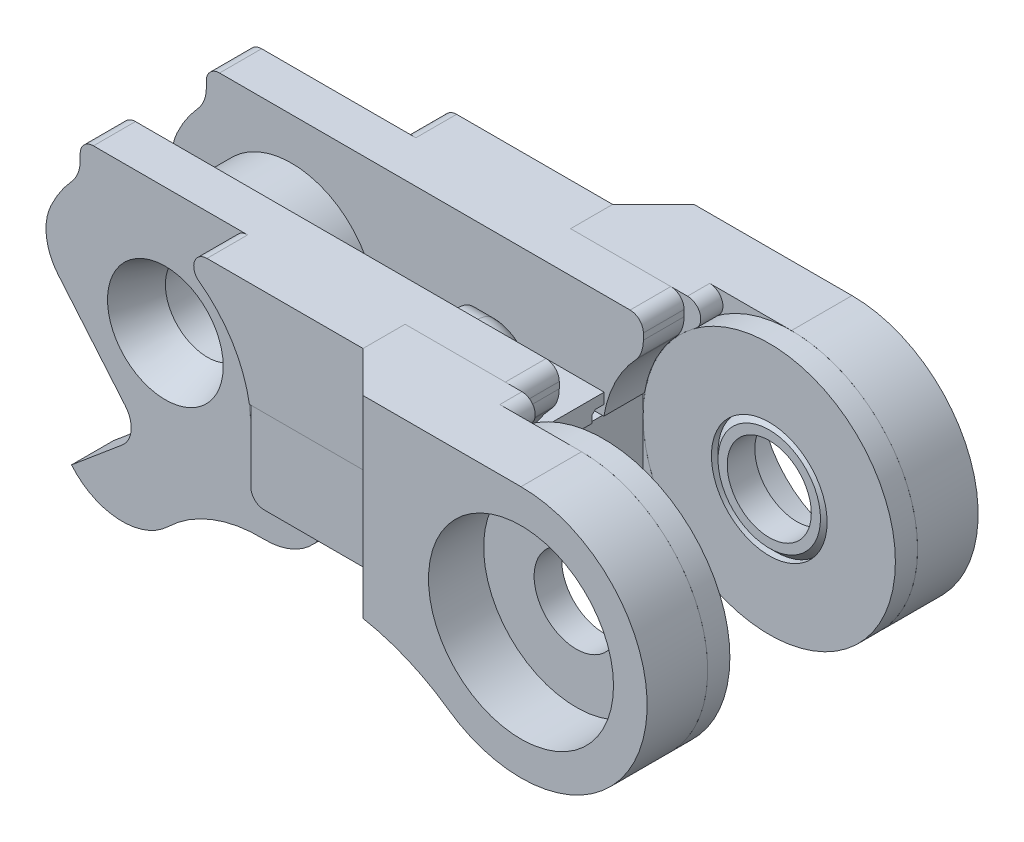
from build123d import *
from build123d.topology import SkipClean

# Parameters (mm, degrees)
SKETCH1_W                  = 7.108223344
SKETCH1_H                  = 0.79375
BOSS_EXTRUDE1_DEPTH        = 1.5875
BOSS_EXTRUDE2_START        = 1.5875
SKETCH1_4_R                = 1.5875
BOSS_EXTRUDE2_DEPTH        = 3.1242
BOSS_EXTRUDE3_START        = -1.5875
SKETCH1_5_R                = 1.5875
BOSS_EXTRUDE3_DEPTH        = 3.1242
BOSS_EXTRUDE4_START        = -4.7117
BOSS_EXTRUDE4_DEPTH        = 9.4234
CUT_EXTRUDE2_DEPTH         = 15.63580129
CUT_EXTRUDE2_DEPTH_BACK    = 15.63580129
SKETCH2_W                  = 0.458271776
SKETCH2_H                  = 0.396875
SKETCH3_R                  = 4.7625
SKETCH3_R_2                = 1.5875
CUT_EXTRUDE3_DEPTH         = 15.63580129
BOSS_EXTRUDE6_START        = 4.7117
SKETCH3_5_R                = 1.5875
BOSS_EXTRUDE6_DEPTH        = 1.5367
CUT_EXTRUDE5_START         = 1.5875
SKETCH4_R                  = 0.79375
CUT_EXTRUDE5_DEPTH         = 17.78779819
CHAMFER7_SIZE              = 0.125
CUT_EXTRUDE11_DEPTH        = 4.7117
FILLET1_R                  = 1.25
CUT_EXTRUDE7_DEPTH         = 16.20029819
CUT_EXTRUDE7_DEPTH_BACK    = 16.20029819
BOSS_EXTRUDE10_START       = 1.5875
BOSS_EXTRUDE10_DEPTH       = 3.1242
FILLET6_R                  = 1.5875
CHAMFER2_SIZE              = 1.5367
SKETCH8_R                  = 0.79375
CUT_EXTRUDE8_START         = 4.7117
CUT_EXTRUDE8_DEPTH         = 1.5875
BOSS_EXTRUDE12_START       = 3.1242
SKETCH3_8_R                = 1.5875
BOSS_EXTRUDE12_DEPTH       = 1.58752
BOSS_EXTRUDE17_START       = 1.5875
BOSS_EXTRUDE17_DEPTH       = 3.1242
CUT_EXTRUDE10_START        = 3.175
CUT_EXTRUDE10_OUTLINE_R    = 1.5875
CUT_EXTRUDE10_DEPTH        = 1.5367
BOSS_EXTRUDE18_START       = 1.5875
BOSS_EXTRUDE18_DEPTH       = 1.5875
FILLET11_R                 = 1.25
FILLET13_R                 = 0.5
BOSS_EXTRUDE14_START       = -1.5875
BOSS_EXTRUDE14_OUTLINE_R   = 3.175
BOSS_EXTRUDE14_OUTLINE_R_2 = 1.5875
BOSS_EXTRUDE14_DEPTH       = 3.175
BOSS_EXTRUDE15_START       = 3.175
BOSS_EXTRUDE15_DEPTH       = 6.2992
FILLET10_R                 = 0.5
CUT_EXTRUDE13_START        = 6.2484
SKETCH15_R                 = 3.4925
SKETCH15_R_2               = 1.5875
CUT_EXTRUDE13_DEPTH        = 2.0828
CUT_EXTRUDE14_START        = 3.1242
SKETCH17_R                 = 4.7625
SKETCH17_R_2               = 2.1844
SKETCH17_R_3               = 1.5875
CUT_EXTRUDE14_DEPTH        = 0.8382
BOSS_EXTRUDE22_START       = 3.1242
SKETCH17_5_R               = 2.1844
SKETCH17_5_R_2             = 1.5875
BOSS_EXTRUDE22_DEPTH       = 0.8382
CHAMFER4_SIZE              = 0.25
FILLET16_START             = 3.1242
FILLET16_DEPTH             = 0.8382
BOSS_EXTRUDE20_START       = 3.9624
SKETCH17_2_R               = 4.7625
SKETCH17_2_R_2             = 2.1844
BOSS_EXTRUDE20_DEPTH       = 0.8382
CUT_EXTRUDE15_START        = 3.175
CUT_EXTRUDE15_DEPTH        = 2.825
FILLET8_R                  = 0.5
CHAMFER5_SIZE              = 0.5969
CHAMFER5_SIZE_2            = 1.5875
SKETCH19_R                 = 4.7752
SKETCH19_R_2               = 2.1844
CUT_EXTRUDE17_DEPTH        = 3.1242
FILLET17_R                 = 0.5


with BuildPart() as part:
    # Sketch1 → Boss-Extrude1 (new, symmetric)
    with BuildSketch(Plane.XY):
        with Locations((0, 1.190625)):
            Rectangle(SKETCH1_W, SKETCH1_H)
    extrude(amount=BOSS_EXTRUDE1_DEPTH, both=True)

    # Sketch2 → Cut-Extrude2 (cut, two sides: drawn at the far end of the back side and taken through both)
    with BuildSketch(Plane(origin=(0, 0, 0), x_dir=(0, 0, -1), z_dir=(1, 0, 0)).offset(-CUT_EXTRUDE2_DEPTH_BACK)):
        with Locations((-1.358364112, 0.9921875)):
            Rectangle(SKETCH2_W, SKETCH2_H)
        with Locations((1.358364112, 0.9921875)):
            Rectangle(SKETCH2_W, SKETCH2_H)
    extrude(amount=CUT_EXTRUDE2_DEPTH + CUT_EXTRUDE2_DEPTH_BACK, mode=Mode.SUBTRACT)


with BuildPart() as body_2:
    # Sketch1<4> → Boss-Extrude2 (new body)
    # profile 1 of 2: a face of its own
    with BuildSketch(Plane.XY.offset(BOSS_EXTRUDE2_START)):
        with BuildLine():
            Line((8.25, 4.7625), (-8.25, 4.7625))
            ThreePointArc((-8.25, 4.7625), (-12.789202371, -1.441196753), (-5.502752244, -3.890248837))
            ThreePointArc((-5.502752244, -3.890248837), (-3.243277531, -2.767556005), (-0.75, -2.38125))
            Line((-0.75, -2.38125), (-3.4875, -2.38125))
            ThreePointArc((-3.4875, -2.38125), (-5.075, -0.79375), (-3.4875, 0.79375))
            Line((-3.4875, 0.79375), (-3.554111672, 0.79375))
            Line((-3.554111672, 0.79375), (-3.554111672, 1.5875))
            Line((-3.554111672, 1.5875), (3.554111672, 1.5875))
            Line((3.554111672, 1.5875), (3.554111672, 0.79375))
            Line((3.554111672, 0.79375), (3.4875, 0.79375))
            ThreePointArc((3.4875, 0.79375), (5.075, -0.79375), (3.4875, -2.38125))
            Line((3.4875, -2.38125), (0.75, -2.38125))
            ThreePointArc((0.75, -2.38125), (3.243277531, -2.767556005), (5.502752244, -3.890248837))
            ThreePointArc((5.502752244, -3.890248837), (12.789202371, -1.441196753), (8.25, 4.7625))
        make_face()
        with Locations((-8.25, 0)):
            Circle(SKETCH1_4_R, mode=Mode.SUBTRACT)
        with Locations((8.25, 0)):
            Circle(SKETCH1_4_R, mode=Mode.SUBTRACT)
    # profile 2 of 2: a face of its own
    with BuildSketch(Plane.XY.offset(BOSS_EXTRUDE2_START)):
        Polygon((-3.554111672, 0.79375), (-3.4875, 0.79375), (0, 0.79375), (3.4875, 0.79375), (3.554111672, 0.79375), (3.554111672, 1.5875), (-3.554111672, 1.5875), align=None)
    extrude(amount=BOSS_EXTRUDE2_DEPTH)

    # Sketch3 → Cut-Extrude3 (cut, through all)
    with BuildSketch(Plane.XY):
        with Locations((8.25, 0)):
            Circle(SKETCH3_R)
        with Locations((8.25, 0)):
            Circle(SKETCH3_R_2, mode=Mode.SUBTRACT)
    extrude(amount=CUT_EXTRUDE3_DEPTH, mode=Mode.SUBTRACT)


with BuildPart() as body_3:
    # Sketch1<5> → Boss-Extrude3 (new body)
    # profile 1 of 2: a face of its own
    with BuildSketch(Plane.XY.offset(BOSS_EXTRUDE3_START)):
        with BuildLine():
            Line((8.25, 4.7625), (-8.25, 4.7625))
            ThreePointArc((-8.25, 4.7625), (-12.789202371, -1.441196753), (-5.502752244, -3.890248837))
            ThreePointArc((-5.502752244, -3.890248837), (-3.243277531, -2.767556005), (-0.75, -2.38125))
            Line((-0.75, -2.38125), (-3.4875, -2.38125))
            ThreePointArc((-3.4875, -2.38125), (-5.075, -0.79375), (-3.4875, 0.79375))
            Line((-3.4875, 0.79375), (-3.554111672, 0.79375))
            Line((-3.554111672, 0.79375), (-3.554111672, 1.5875))
            Line((-3.554111672, 1.5875), (3.554111672, 1.5875))
            Line((3.554111672, 1.5875), (3.554111672, 0.79375))
            Line((3.554111672, 0.79375), (3.4875, 0.79375))
            ThreePointArc((3.4875, 0.79375), (5.075, -0.79375), (3.4875, -2.38125))
            Line((3.4875, -2.38125), (0.75, -2.38125))
            ThreePointArc((0.75, -2.38125), (3.243277531, -2.767556005), (5.502752244, -3.890248837))
            ThreePointArc((5.502752244, -3.890248837), (12.789202371, -1.441196753), (8.25, 4.7625))
        make_face()
        with Locations((-8.25, 0)):
            Circle(SKETCH1_5_R, mode=Mode.SUBTRACT)
        with Locations((8.25, 0)):
            Circle(SKETCH1_5_R, mode=Mode.SUBTRACT)
    # profile 2 of 2: a face of its own
    with BuildSketch(Plane.XY.offset(BOSS_EXTRUDE3_START)):
        Polygon((-3.554111672, 0.79375), (-3.4875, 0.79375), (0, 0.79375), (3.4875, 0.79375), (3.554111672, 0.79375), (3.554111672, 1.5875), (-3.554111672, 1.5875), align=None)
    extrude(amount=-BOSS_EXTRUDE3_DEPTH)


with BuildPart() as body_4:
    # Sketch1<7> → Boss-Extrude4 (new body)
    with BuildSketch(Plane.XY.offset(BOSS_EXTRUDE4_START)):
        Polygon((-3.4875, -2.38125), (-0.75, -2.38125), (0, -2.38125), (0.75, -2.38125), (3.4875, -2.38125), (3.4875, 0), (3.4875, 0.79375), (0, 0.79375), (-3.4875, 0.79375), (-3.4875, 0), align=None)
    extrude(amount=BOSS_EXTRUDE4_DEPTH)


with BuildPart() as body_4_2:
    # of the pieces the cut leaves, the one that is kept (cut_extrude3_keep)
    add(body_2.part.solids().sort_by_distance((-0.75, -2.38125, 1.5875))[0])

    # Sketch13 → Cut-Extrude11 (cut)
    with BuildSketch(Plane.XY):
        with BuildLine():
            ThreePointArc((8.25, 4.7625), (6.524728282, 4.439013826), (5.033829917, 3.5125))
            Line((5.033829917, 3.5125), (5.033829917, 4.7625))
            Line((5.033829917, 4.7625), (8.25, 4.7625))
        make_face()
    extrude(amount=CUT_EXTRUDE11_DEPTH, mode=Mode.SUBTRACT)

    # Fillet1
    fillet1_edges = [body_4_2.edges().sort_by_distance(p)[0] for p in [
        (5.033829917, 3.5125, 3.1496),
    ]]
    fillet(fillet1_edges, radius=FILLET1_R)

    # Sketch6 → Cut-Extrude7 (cut, two sides: drawn at the far end of the back side and taken through both)
    with SkipClean():  # the faces are left unmerged after this step: merging them gives an invalid solid
        with BuildSketch(Plane.XY.offset(-CUT_EXTRUDE7_DEPTH_BACK)):
            with BuildLine():
                ThreePointArc((-12.784199222, 1.456860895), (-12.527084339, -2.094744807), (-9.878870933, -4.475286106))
                ThreePointArc((-9.878870933, -4.475286106), (-9.31783718, -3.397550295), (-9.68320071, -2.238765223))
                Line((-9.68320071, -2.238765223), (-12.784199222, 1.456860895))
            make_face()
            with BuildLine():
                ThreePointArc((-4.064703864, -2.272598183), (-4.690612467, -3.16420079), (-5.502752244, -3.890248837))
                ThreePointArc((-5.502752244, -3.890248837), (-3.818585011, -2.974003651), (-1.96825258, -2.471814041))
                ThreePointArc((-1.96825258, -2.471814041), (-1.967021933, -2.426539453), (-1.966611672, -2.38125))
                Line((-1.966611672, -2.38125), (-3.4875, -2.38125))
                ThreePointArc((-3.4875, -2.38125), (-3.781170529, -2.353850596), (-4.064703864, -2.272598183))
            make_face()
            with BuildLine():
                ThreePointArc((-1.966611672, -2.38125), (-1.967021933, -2.426539453), (-1.96825258, -2.471814041))
                ThreePointArc((-1.96825258, -2.471814041), (-1.360807088, -2.403922205), (-0.75, -2.38125))
                Line((-0.75, -2.38125), (-1.966611672, -2.38125))
            make_face()
        extrude(amount=CUT_EXTRUDE7_DEPTH + CUT_EXTRUDE7_DEPTH_BACK, mode=Mode.SUBTRACT)

    # Boss-Extrude10: read off the stored shape, not the designer's step
    # Boss-Extrude10 outline → Boss-Extrude10 (add)
    with BuildSketch(Plane.XY.offset(BOSS_EXTRUDE10_START)):
        with BuildLine():
            Line((-1.966611672, -2.38125), (-3.4875, -2.38125))
            ThreePointArc((-3.4875, -2.38125), (-3.781170529, -2.353850596), (-4.064703864, -2.272598183))
            ThreePointArc((-4.064703864, -2.272598183), (-6.562757879, -4.453607557), (-9.878870933, -4.475286106))
            Line((-9.878870933, -4.475286106), (-11.79398204, -6.082255131))
            ThreePointArc((-11.79398204, -6.082255131), (-10.011619172, -6.9717592), (-8.14497636, -6.276288498))
            ThreePointArc((-8.14497636, -6.276288498), (-6.481384422, -5.215153517), (-4.53680352, -4.880264427))
            ThreePointArc((-4.53680352, -4.880264427), (-2.723837966, -4.17366173), (-1.966611672, -2.38125))
        make_face()
    extrude(amount=BOSS_EXTRUDE10_DEPTH)

    # Fillet6
    fillet6_edges = [body_4_2.edges().sort_by_distance(p)[0] for p in [
        (-12.784199222, 1.456860895, 3.1496),
    ]]
    fillet(fillet6_edges, radius=FILLET6_R)


with BuildPart() as body_4_3:
    # Sketch3<5> → Boss-Extrude6 (new body)
    with BuildSketch(Plane.XY.offset(BOSS_EXTRUDE6_START)):
        with BuildLine():
            ThreePointArc((0.75, -2.38125), (3.243277531, -2.767556005), (5.502752244, -3.890248837))
            ThreePointArc((5.502752244, -3.890248837), (12.789202371, -1.441196753), (8.25, 4.7625))
            Line((8.25, 4.7625), (0.75, 4.7625))
            Line((0.75, 4.7625), (0.75, -2.38125))
        make_face()
        with Locations((8.25, 0)):
            Circle(SKETCH3_5_R, mode=Mode.SUBTRACT)
    extrude(amount=BOSS_EXTRUDE6_DEPTH)

    # Chamfer2
    chamfer2_edges = [body_4_3.edges().sort_by_distance(p)[0] for p in [
        (0.75, 1.190625, 6.2484),
    ]]
    chamfer(chamfer2_edges, length=CHAMFER2_SIZE - 0.0001)  # a hair under: the kernel refuses the full size

    # Sketch3<8> → Boss-Extrude12 (add)
    with BuildSketch(Plane.XY.offset(BOSS_EXTRUDE12_START)):
        with BuildLine():
            ThreePointArc((0.75, -2.38125), (3.243277531, -2.767556005), (5.502752244, -3.890248837))
            ThreePointArc((5.502752244, -3.890248837), (12.789202371, -1.441196753), (8.25, 4.7625))
            Line((8.25, 4.7625), (0.75, 4.7625))
            Line((0.75, 4.7625), (0.75, -2.38125))
        make_face()
        with Locations((8.25, 0)):
            Circle(SKETCH3_8_R, mode=Mode.SUBTRACT)
    extrude(amount=BOSS_EXTRUDE12_DEPTH)

    # Sketch15 → Cut-Extrude13 (cut)
    with BuildSketch(Plane.XY.offset(CUT_EXTRUDE13_START)):
        with Locations((8.25, 0)):
            Circle(SKETCH15_R)
        with Locations((8.25, 0)):
            Circle(SKETCH15_R_2, mode=Mode.SUBTRACT)
    extrude(amount=-CUT_EXTRUDE13_DEPTH, mode=Mode.SUBTRACT)

    # Sketch17 → Cut-Extrude14 (cut)
    # profile 1 of 2: a face of its own
    with BuildSketch(Plane.XY.offset(CUT_EXTRUDE14_START)):
        with Locations((8.25, 0)):
            Circle(SKETCH17_R)
        with Locations((8.25, 0)):
            Circle(SKETCH17_R_2, mode=Mode.SUBTRACT)
    # profile 2 of 2: a face of its own
    with BuildSketch(Plane.XY.offset(CUT_EXTRUDE14_START)):
        with Locations((8.25, 0)):
            Circle(SKETCH17_R_2)
        with Locations((8.25, 0)):
            Circle(SKETCH17_R_3, mode=Mode.SUBTRACT)
    extrude(amount=CUT_EXTRUDE14_DEPTH, mode=Mode.SUBTRACT)

    # Sketch17<5> → Boss-Extrude22 (add)
    with BuildSketch(Plane.XY.offset(BOSS_EXTRUDE22_START)):
        with Locations((8.25, 0)):
            Circle(SKETCH17_5_R)
        with Locations((8.25, 0)):
            Circle(SKETCH17_5_R_2, mode=Mode.SUBTRACT)
    extrude(amount=BOSS_EXTRUDE22_DEPTH)

    # Chamfer4
    chamfer4_edges = [body_4_3.edges().sort_by_distance(p)[0] for p in [
        (6.0656, 0, 3.1242),
    ]]
    chamfer(chamfer4_edges, length=CHAMFER4_SIZE)

    # Fillet16: read off the stored shape, not the designer's step
    # Fillet16 outline → Fillet16 (cut)
    with BuildSketch(Plane.XY.offset(FILLET16_START)):
        with BuildLine():
            ThreePointArc((5.502752244, -3.890248837), (4.632169572, -3.097209912), (3.982794411, -2.114796138))
            ThreePointArc((3.982794411, -2.114796138), (3.911520832, -2.665572281), (3.375465155, -2.81075697))
            ThreePointArc((3.375465155, -2.81075697), (4.47838419, -3.273105151), (5.502752244, -3.890248837))
        make_face()
        with BuildLine():
            ThreePointArc((5.163740128, 4.7625), (5.639394446, 4.416619982), (5.456971469, 3.857511876))
            ThreePointArc((5.456971469, 3.857511876), (6.782007163, 4.530607385), (8.25, 4.7625))
            Line((8.25, 4.7625), (5.163740128, 4.7625))
        make_face()
    extrude(amount=FILLET16_DEPTH, mode=Mode.SUBTRACT)


with BuildPart() as cut_extrude5_tool:
    # Sketch4 → Cut-Extrude5 (new, through all)
    with BuildSketch(Plane(origin=(0, 0, 0), x_dir=(1, 0, 0), z_dir=(0, 1, 0)).offset(CUT_EXTRUDE5_START)):
        with Locations(Location((-1.172861672, 0, 0), (0, 0, 270))):
            Circle(SKETCH4_R)
        with Locations(Location((1.172861672, 0, 0), (0, 0, 270))):
            Circle(SKETCH4_R)
    extrude(amount=-CUT_EXTRUDE5_DEPTH)


with BuildPart() as part_1:
    add(part.part)

    # Cut-Extrude5: cut by cut_extrude5_tool
    add(cut_extrude5_tool.part, mode=Mode.SUBTRACT)

    # Chamfer7
    chamfer7_edges = [part_1.edges().sort_by_distance(p)[0] for p in [
        (0, 1.190625, 1.129228224),
        (0, 1.190625, -1.129228224),
    ]]
    chamfer(chamfer7_edges, length=CHAMFER7_SIZE)


with BuildPart() as body_4_1:
    add(body_4.part)

    # Cut-Extrude5: cut by cut_extrude5_tool
    add(cut_extrude5_tool.part, mode=Mode.SUBTRACT)


with BuildPart() as body_5:
    # Sweep3: sweep along a path in Sketch7
    with BuildLine(Plane.XY) as sweep3_path:
        Line((1.172861672, -4.7625), (1.172861672, 1.5875))
        ThreePointArc((1.172861672, 1.5875), (0.94037768, 2.148766008), (0.379111672, 2.38125))
        Line((0.379111672, 2.38125), (-0.379111672, 2.38125))
        ThreePointArc((-0.379111672, 2.38125), (-0.94037768, 2.148766008), (-1.172861672, 1.5875))
        Line((-1.172861672, 1.5875), (-1.172861672, -4.7625))
    # Sketch8 → Sweep3 (sweep)
    with BuildSketch(Plane(origin=(0, -4.7625, 0), x_dir=(-1, 0, 0), z_dir=(0, -1, 0))):
        with Locations((-1.172861672, 0)):
            Circle(SKETCH8_R)
    sweep(path=sweep3_path.line)


with BuildPart() as cut_extrude8_tool:
    # Sketch3<6> → Cut-Extrude8 (new body)
    with BuildSketch(Plane.XY.offset(CUT_EXTRUDE8_START)):
        with BuildLine():
            Line((0.75, -2.38125), (3.4875, -2.38125))
            ThreePointArc((3.4875, -2.38125), (3.781170529, -2.353850596), (4.064703864, -2.272598183))
            ThreePointArc((4.064703864, -2.272598183), (4.157039269, 2.434969959), (8.25, 4.7625))
            Line((8.25, 4.7625), (0.75, 4.7625))
            Line((0.75, 4.7625), (0.75, -2.38125))
        make_face()
    cut_extrude8 = extrude(amount=-CUT_EXTRUDE8_DEPTH)


with BuildPart() as body_4_4:
    add(body_4_1.part)

    # Cut-Extrude8: cut by cut_extrude8_tool
    add(cut_extrude8_tool.part, mode=Mode.SUBTRACT)

    # Mirror1: Cut-Extrude8 across plane
    add(cut_extrude8.mirror(Plane.XY), mode=Mode.SUBTRACT)

    # Sketch12 → Boss-Extrude15 (add)
    with BuildSketch(Plane.XY.offset(BOSS_EXTRUDE15_START)):
        with BuildLine():
            Line((-3.4875, -2.38125), (-3.4875, 0.79375))
            ThreePointArc((-3.4875, 0.79375), (-3.520695867, 0.793402886), (-3.553877217, 0.792361697))
            ThreePointArc((-3.553877217, 0.792361697), (-5.074652886, -0.826945867), (-3.4875, -2.38125))
        make_face()
    extrude(amount=-BOSS_EXTRUDE15_DEPTH)

    # Fillet10
    fillet10_edges = [body_4_4.edges().sort_by_distance(p)[0] for p in [
        (-3.4875, -2.38125, -3.91795),
        (-3.4875, -2.38125, 3.94335),
    ]]
    fillet(fillet10_edges, radius=FILLET10_R)


with BuildPart() as body_4_2_1:
    add(body_4_2.part)

    # Cut-Extrude8: cut by cut_extrude8_tool
    add(cut_extrude8_tool.part, mode=Mode.SUBTRACT)

    # Sketch9<6> → Boss-Extrude17 (add)
    with BuildSketch(Plane.XY.offset(BOSS_EXTRUDE17_START)):
        with BuildLine():
            ThreePointArc((-12.140877098, 0.690179443), (-12.508972733, 1.608161964), (-12.262172317, 2.56590716))
            ThreePointArc((-12.262172317, 2.56590716), (-12.426849341, 2.288085626), (-12.572318593, 1.999742041))
            ThreePointArc((-12.572318593, 1.999742041), (-12.739666995, 0.895924456), (-12.289260564, -0.125619862))
            Line((-12.289260564, -0.125619862), (-9.761845227, -3.13767617))
            ThreePointArc((-9.761845227, -3.13767617), (-9.543329991, -3.830717955), (-9.878870933, -4.475286106))
            ThreePointArc((-9.878870933, -4.475286106), (-9.31783718, -3.397550295), (-9.68320071, -2.238765223))
            Line((-9.68320071, -2.238765223), (-12.140877098, 0.690179443))
        make_face()
    extrude(amount=BOSS_EXTRUDE17_DEPTH)

    # Cut-Extrude10: read off the stored shape, not the designer's step
    # Cut-Extrude10 outline → Cut-Extrude10 (cut)
    with BuildSketch(Plane.XY.offset(CUT_EXTRUDE10_START)):
        with BuildLine():
            ThreePointArc((-3.4875, -2.38125), (-5.074652886, -0.826945867), (-3.553877217, 0.792361697))
            ThreePointArc((-3.553877217, 0.792361697), (-5.175281828, 3.636965001), (-8.25, 4.7625))
            ThreePointArc((-8.25, 4.7625), (-10.814920543, 4.012803118), (-12.572318593, 1.999742041))
            ThreePointArc((-12.572318593, 1.999742041), (-12.739666995, 0.895924456), (-12.289260564, -0.125619862))
            Line((-12.289260564, -0.125619862), (-9.761845227, -3.13767617))
            ThreePointArc((-9.761845227, -3.13767617), (-9.543329991, -3.830717955), (-9.878870933, -4.475286106))
            Line((-9.878870933, -4.475286106), (-11.79398204, -6.082255131))
            ThreePointArc((-11.79398204, -6.082255131), (-10.011619172, -6.9717592), (-8.14497636, -6.276288498))
            ThreePointArc((-8.14497636, -6.276288498), (-6.481384422, -5.215153517), (-4.53680352, -4.880264427))
            ThreePointArc((-4.53680352, -4.880264427), (-2.723837966, -4.17366173), (-1.966611672, -2.38125))
            Line((-1.966611672, -2.38125), (-3.4875, -2.38125))
        make_face()
        with Locations((-8.25, 0)):
            Circle(CUT_EXTRUDE10_OUTLINE_R, mode=Mode.SUBTRACT)
    extrude(amount=CUT_EXTRUDE10_DEPTH, mode=Mode.SUBTRACT)

    # Sketch14 → Boss-Extrude18 (add)
    with BuildSketch(Plane.XY.offset(BOSS_EXTRUDE18_START)):
        with BuildLine():
            ThreePointArc((-8.25, 4.7625), (-9.975271718, 4.439013826), (-11.466170083, 3.5125))
            Line((-11.466170083, 3.5125), (-11.466170083, 4.7625))
            Line((-11.466170083, 4.7625), (-8.25, 4.7625))
        make_face()
    extrude(amount=BOSS_EXTRUDE18_DEPTH)

    # Fillet11
    fillet11_edges = [body_4_2_1.edges().sort_by_distance(p)[0] for p in [
        (-11.466170083, 3.5125, 2.38125),
    ]]
    fillet(fillet11_edges, radius=FILLET11_R)

    # Fillet13
    fillet13_edges = [body_4_2_1.edges().sort_by_distance(p)[0] for p in [
        (5.033829917, 4.7625, 2.35585),
        (-11.466170083, 4.7625, 2.38125),
    ]]
    fillet(fillet13_edges, radius=FILLET13_R)

    # Cut-Extrude15: read off the stored shape, not the designer's step
    # Cut-Extrude15 outline → Cut-Extrude15 (cut)
    with BuildSketch(Plane.XY.offset(CUT_EXTRUDE15_START)):
        with BuildLine():
            ThreePointArc((-3.553877217, 0.792361697), (-3.547478916, 0.792616534), (-3.54107964, 0.79284556))
            ThreePointArc((-3.54107964, 0.79284556), (-5.035542032, 3.531259692), (-7.901964384, 4.7625))
            Line((-7.901964384, 4.7625), (-8.25, 4.7625))
            ThreePointArc((-8.25, 4.7625), (-5.175281828, 3.636965001), (-3.553877217, 0.792361697))
        make_face()
    extrude(amount=CUT_EXTRUDE15_DEPTH, mode=Mode.SUBTRACT)

    # Fillet8
    fillet8_edges = [body_4_2_1.edges().sort_by_distance(p)[0] for p in [
        (-7.901964384, 4.7625, 3.94335),
    ]]
    fillet(fillet8_edges, radius=FILLET8_R)

    # Chamfer5
    # the kernel refuses this chamfer: 1.5875, 0.5969 mm, written as the material it takes off along each edge
    with BuildSketch(Plane(origin=(-8.25, 0, 3.175), x_dir=(1, 0, 0), z_dir=(0, -1, 0))) as chamfer5_piece_1:
        Polygon((1.5875 + CHAMFER5_SIZE, 0), (1.5875, -CHAMFER5_SIZE_2), (1.5875, 0), align=None)
    revolve(axis=Axis((-8.25, 0, 3.175), (0, 0, 1)), mode=Mode.SUBTRACT)

    # Sketch19 → Cut-Extrude17 (cut)
    with BuildSketch(Plane.XY):
        with Locations((8.25, 0)):
            Circle(SKETCH19_R)
        with Locations((8.25, 0)):
            Circle(SKETCH19_R_2, mode=Mode.SUBTRACT)
    extrude(amount=CUT_EXTRUDE17_DEPTH, mode=Mode.SUBTRACT)

    # Fillet17
    fillet17_edges = [body_4_2_1.edges().sort_by_distance(p)[0] for p in [
        (4.8108939, 3.312866474, 2.35585),
    ]]
    fillet(fillet17_edges, radius=FILLET17_R)


with BuildPart() as body_6:
    # Boss-Extrude14: read off the stored shape, not the designer's step
    # Boss-Extrude14 outline → Boss-Extrude14 (new body)
    with BuildSketch(Plane.XY.offset(BOSS_EXTRUDE14_START)):
        with Locations((-8.25, 0)):
            Circle(BOSS_EXTRUDE14_OUTLINE_R)
        with Locations((-8.25, 0)):
            Circle(BOSS_EXTRUDE14_OUTLINE_R_2, mode=Mode.SUBTRACT)
    extrude(amount=BOSS_EXTRUDE14_DEPTH)


with BuildPart() as body_7:
    # Sketch17<2> → Boss-Extrude20 (new body)
    with BuildSketch(Plane.XY.offset(BOSS_EXTRUDE20_START)):
        with Locations((8.25, 0)):
            Circle(SKETCH17_2_R)
        with Locations((8.25, 0)):
            Circle(SKETCH17_2_R_2, mode=Mode.SUBTRACT)
    extrude(amount=-BOSS_EXTRUDE20_DEPTH)


with BuildPart() as body_8:
    # Mirror2: mirrored copy
    add(body_4_3.part.mirror(Plane.XY))


with BuildPart() as body_9:
    # Mirror2 2: mirrored copy
    add(body_7.part.mirror(Plane.XY))


with BuildPart() as body_10:
    # Mirror2 3: mirrored copy
    add(body_4_2_1.part.mirror(Plane.XY))


solid = Compound([body_4_3.part, part_1.part, body_5.part, body_4_4.part, body_4_2_1.part, body_6.part, body_7.part, body_8.part, body_9.part, body_10.part])
